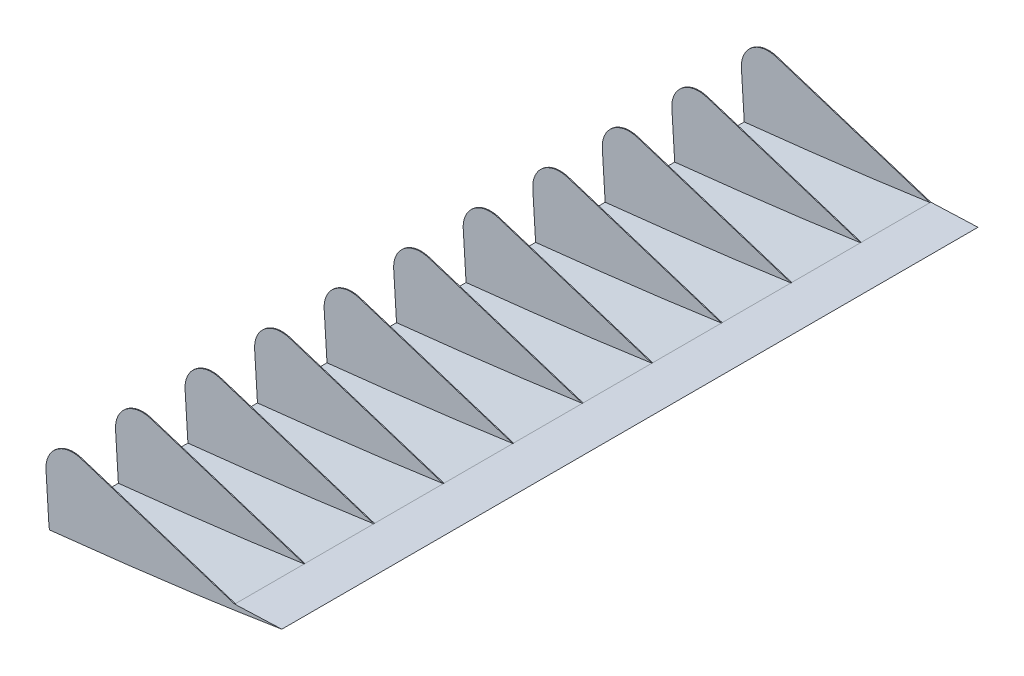
from build123d import *

# Parameters (mm, degrees)
BOSS_EXTRUDE1_DEPTH = 650
BOSS_EXTRUDE2_START = -0.7112
BOSS_EXTRUDE2_DEPTH = 0.7112
LPATTERN1_COUNT     = 11
LPATTERN1_PITCH     = 64.929


# Read off the part's stored shape, not the designer's step: Boss-Extrude2
with BuildPart() as part:
    # Sketch1 → Boss-Extrude1 (new body)
    with BuildSketch(Plane.XY):
        with BuildLine():
            add(Edge.make_bspline(
                [(-112.898494578, 0.99146631), (-110.355982987, 1.262339099), (-105.259380368, 1.808389528), (-95.162712882, 2.902575782), (-82.658600361, 4.281227817), (-67.864804262, 5.950995414), (-48.419089864, 8.198779354), (-24.648701462, 11.048580313), (2.987237789, 14.533371756), (29.350050206, 18.036965667), (47.273220771, 20.55034649), (57.461014612, 22.023800415), (59.555137323, 22.328856294), (60.599627559, 22.481560095)],
                knots=[0.938155776, 0.938155776, 0.938155776, 0.938155776, 0.940088408, 0.94202104, 0.945886304, 0.949751568, 0.953616832, 0.96134736, 0.969077888, 0.976808416, 0.984232202, 0.985198518, 0.986164834, 0.986164834, 0.986164834, 0.986164834], degree=3))
            Line((60.599627559, 22.481560095), (104.654430058, 24.21413648))
            add(Edge.make_bspline(
                [(-112.368804727, -3.980397391), (-30.684146875, 4.722080559), (42.524377626, 14.095206887), (104.654430058, 24.21413648)],
                knots=[0.938155776, 0.938155776, 0.938155776, 0.938155776, 1, 1, 1, 1], degree=3))
            Line((-112.368804727, -3.980397391), (-112.898494578, 0.99146631))
        make_face()
    extrude(amount=BOSS_EXTRUDE1_DEPTH)

    # Boss-Extrude2 outline → Boss-Extrude2 (add)
    with BuildSketch(Plane.XY.offset(650).offset(BOSS_EXTRUDE2_START)):
        with BuildLine():
            ThreePointArc((-82.963014518, 68.430375082), (-105.947446125, 64.342164511), (-115.534774611, 43.056472263))
            Line((-115.534774611, 43.056472263), (-112.898494578, 0.99146631))
            add(Edge.make_bspline(
                [(-112.898494578, 0.99146631), (-110.355982987, 1.262339099), (-105.259380368, 1.808389528), (-95.162712882, 2.902575782), (-82.658600361, 4.281227817), (-67.864804262, 5.950995414), (-48.419089864, 8.198779354), (-24.648701462, 11.048580313), (2.987237789, 14.533371756), (29.350050206, 18.036965667), (47.273220771, 20.55034649), (57.461014612, 22.023800415), (59.555137323, 22.328856294), (60.599627559, 22.481560095)],
                knots=[0.938155776, 0.938155776, 0.938155776, 0.938155776, 0.940088408, 0.94202104, 0.945886304, 0.949751568, 0.953616832, 0.96134736, 0.969077888, 0.976808416, 0.984232202, 0.985198518, 0.986164834, 0.986164834, 0.986164834, 0.986164834], degree=3))
            Line((60.599627559, 22.481560095), (-82.963014518, 68.430375082))
        make_face()
    boss_extrude2 = extrude(amount=BOSS_EXTRUDE2_DEPTH)

    # LPattern1: Boss-Extrude2 ×11
    with Locations(*[(0, 0, -i * LPATTERN1_PITCH) for i in range(1, LPATTERN1_COUNT)]):
        add(boss_extrude2)


solid = part.part
